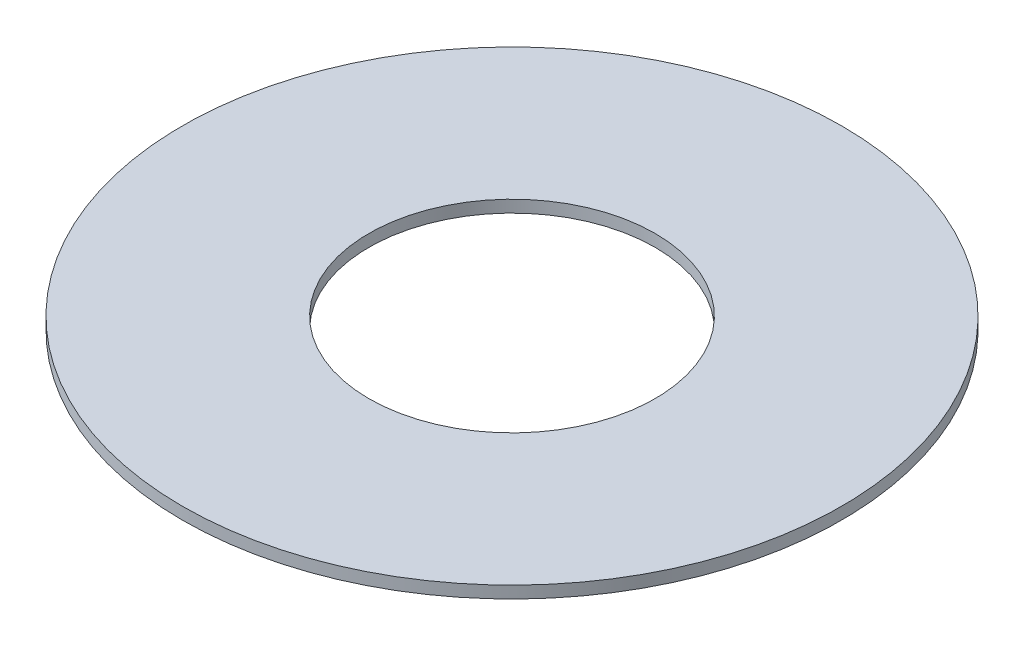
from build123d import *

# Parameters (mm, degrees)
SKETCH1_R           = 22.225
SKETCH1_R_2         = 9.652
BOSS_EXTRUDE1_DEPTH = 0.8128


with BuildPart() as part:
    # Sketch1 → Boss-Extrude1 (new body)
    with BuildSketch(Plane(origin=(0, 0, 0), x_dir=(1, 0, 0), z_dir=(0, 1, 0))):
        Circle(SKETCH1_R)
        Circle(SKETCH1_R_2, mode=Mode.SUBTRACT)
    extrude(amount=BOSS_EXTRUDE1_DEPTH)


solid = part.part
